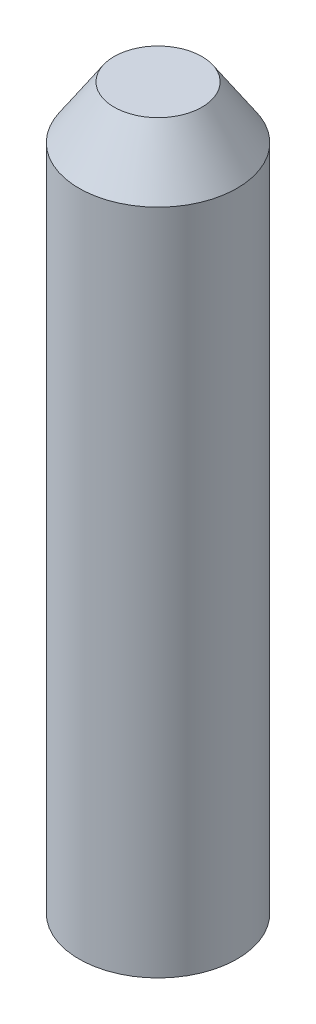
from build123d import *

# Parameters (mm, degrees)
SKETCH_3_R          = 4
SKETCH_3_R_2        = 2.25
CUT_EXTRUDE_1_DEPTH = 1.5


with BuildPart() as part:
    # Эскиз2 → Revolve 329 (revolve)
    with BuildSketch(Plane.XY):
        Polygon((0, 0), (0, 41), (2.5, 41), (4.5, 38), (4.5, 0), align=None)
    revolve(axis=Axis((0, 0, 0), (0, 1, 0)))

    # Эскиз3 → Вырез-Вытянуть1 (cut)
    with BuildSketch(Plane.XZ):
        Circle(SKETCH_3_R)
        Circle(SKETCH_3_R_2, mode=Mode.SUBTRACT)
    extrude(amount=-CUT_EXTRUDE_1_DEPTH, mode=Mode.SUBTRACT)


solid = part.part
